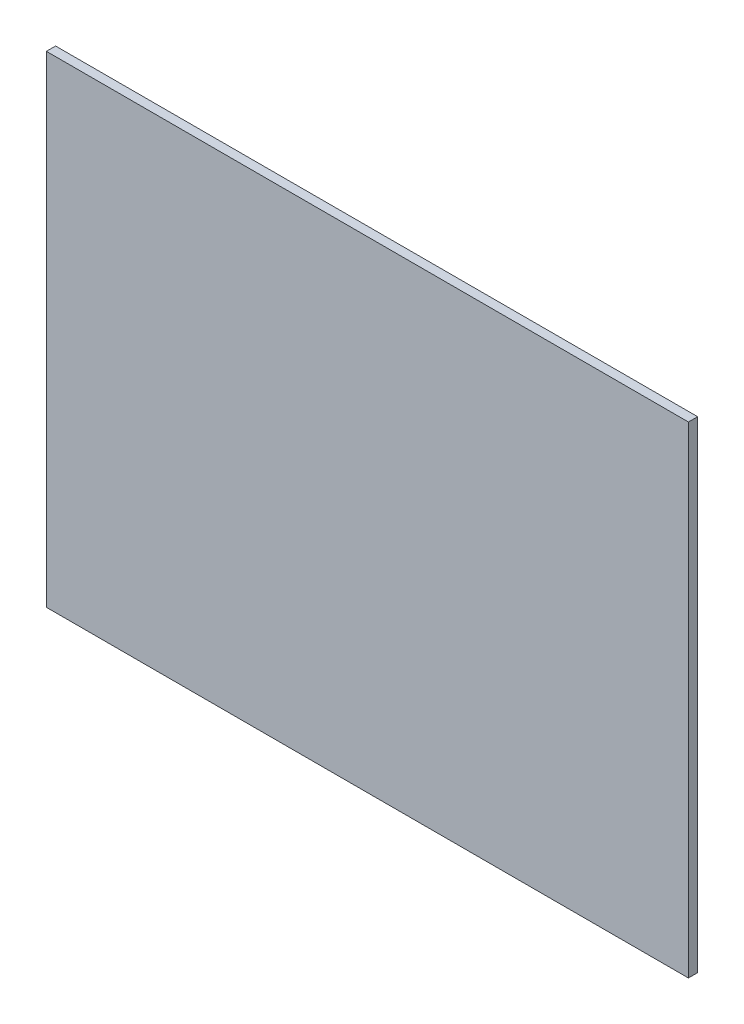
from build123d import *

# Parameters (mm, degrees)
SKETCH1_W           = 1219.2
SKETCH1_H           = 914.4
BOSS_EXTRUDE1_DEPTH = 17.4752


with BuildPart() as part:
    # Sketch1 → Boss-Extrude1 (new body)
    with BuildSketch(Plane.XY):
        Rectangle(SKETCH1_W, SKETCH1_H)
    extrude(amount=BOSS_EXTRUDE1_DEPTH)


solid = part.part
